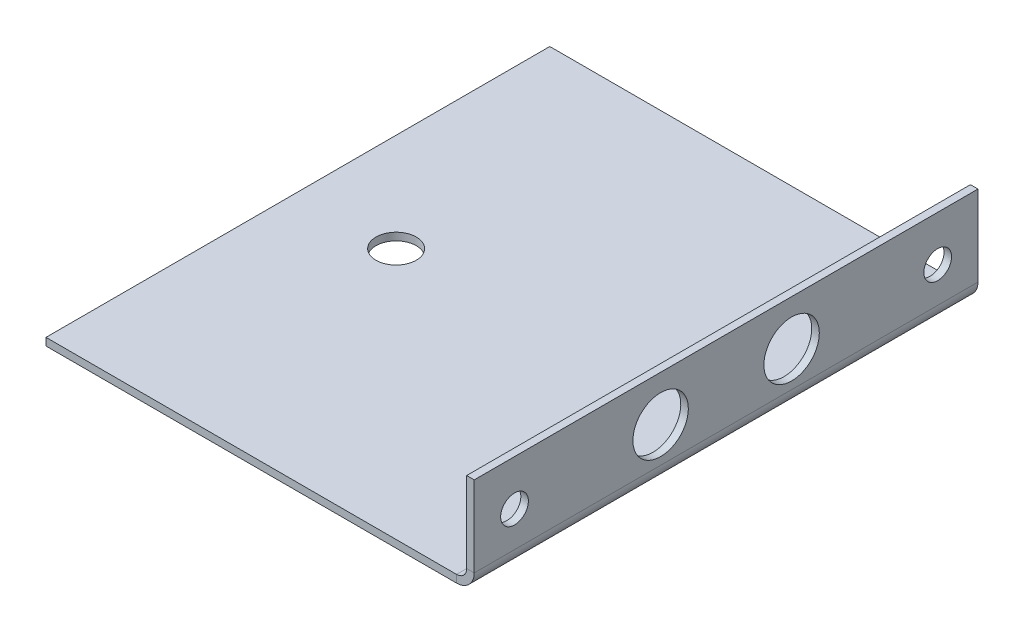
from build123d import *

# Parameters (mm, degrees)
BASE_FLANGE1_DEPTH = 100
SKETCH6_R          = 5.5
SKETCH6_R_2        = 2.75
CUT_EXTRUDE1_DEPTH = 10
SKETCH7_R          = 4
CUT_EXTRUDE2_DEPTH = 10


# Sheet-metal steps are written as plain solids
with BuildPart() as part:
    # Sketch1 → Base-Flange1 (new body)
    with BuildSketch(Plane.XY):
        with BuildLine():
            Line((0, 19.5), (0, 3.5))
            ThreePointArc((0, 3.5), (-1.025126266, 1.025126266), (-3.5, 0))
            Line((-3.5, 0), (-85, 0))
            Line((-85, 0), (-85, 1.5))
            Line((-85, 1.5), (-3.5, 1.5))
            ThreePointArc((-3.5, 1.5), (-2.085786438, 2.085786438), (-1.5, 3.5))
            Line((-1.5, 3.5), (-1.5, 19.5))
            Line((-1.5, 19.5), (0, 19.5))
        make_face()
    extrude(amount=BASE_FLANGE1_DEPTH)

    # Sketch6 → Cut-Extrude1 (cut)
    with BuildSketch(Plane.ZY.offset(1.5)):
        with Locations(Location((37, 10.5, 0), (0, 0, 270))):
            Circle(SKETCH6_R)
        with Locations(Location((8, 10.5, 0), (0, 0, 270))):
            Circle(SKETCH6_R_2)
        with Locations(Location((92, 10.5, 0), (0, 0, 90))):
            Circle(SKETCH6_R_2)
        with Locations(Location((63, 10.5, 0), (0, 0, 90))):
            Circle(SKETCH6_R)
    extrude(amount=-CUT_EXTRUDE1_DEPTH, mode=Mode.SUBTRACT)

    # Sketch7 → Cut-Extrude2 (cut)
    with BuildSketch(Plane(origin=(0, 1.5, 0), x_dir=(1, 0, 0), z_dir=(0, 1, 0))):
        with Locations(Location((-65.5, -50, 0), (0, 0, 180))):
            Circle(SKETCH7_R)
    extrude(amount=-CUT_EXTRUDE2_DEPTH, mode=Mode.SUBTRACT)


solid = part.part
